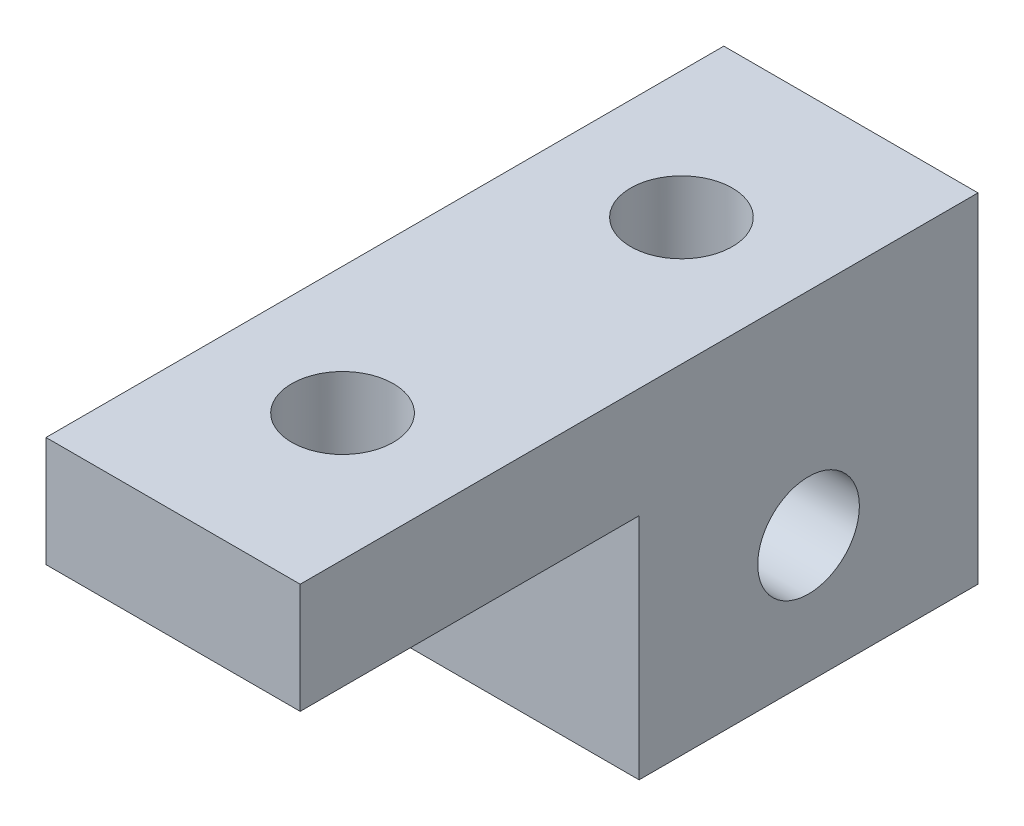
from build123d import *

# Parameters (mm, degrees)
SKETCH_1_R               = 0.6
EXTRUDE_1_DEPTH          = 3
CUT_EXTRUDE_1_DEPTH      = 8.158910532
CUT_EXTRUDE_1_DEPTH_BACK = 8.158910532
SKETCH_3_R               = 0.6
SKETCH_5_W               = 4
SKETCH_5_H               = 0.2
CUT_EXTRUDE_2_DEPTH      = 8.158910532


with BuildPart() as part:
    # 草图1 → 凸台-拉伸1 (new body)
    with BuildSketch(Plane(origin=(0, 0, 0), x_dir=(0, 0, -1), z_dir=(1, 0, 0))):
        Polygon((2, 2.5), (-6, 2.5), (-6, 1), (-2, 1), (-2, -1.5), (2, -1.5), align=None)
        Circle(SKETCH_1_R, mode=Mode.SUBTRACT)
    extrude(amount=EXTRUDE_1_DEPTH)

    # 草图3 → 切除-拉伸1 (cut, two sides: drawn at the far end of the back side and taken through both)
    with BuildSketch(Plane.XZ.offset(-1).offset(-CUT_EXTRUDE_1_DEPTH_BACK)):
        with Locations((1.5, 4)):
            Circle(SKETCH_3_R)
        with Locations((1.5, 0)):
            Circle(SKETCH_3_R)
    extrude(amount=CUT_EXTRUDE_1_DEPTH + CUT_EXTRUDE_1_DEPTH_BACK, mode=Mode.SUBTRACT)

    # 草图5 → 切除-拉伸2 (cut, through all)
    with BuildSketch(Plane(origin=(3, 0, 0), x_dir=(0, 0, -1), z_dir=(1, 0, 0))):
        with Locations((-4, 1.1)):
            Rectangle(SKETCH_5_W, SKETCH_5_H)
    extrude(amount=-CUT_EXTRUDE_2_DEPTH, mode=Mode.SUBTRACT)


solid = part.part
